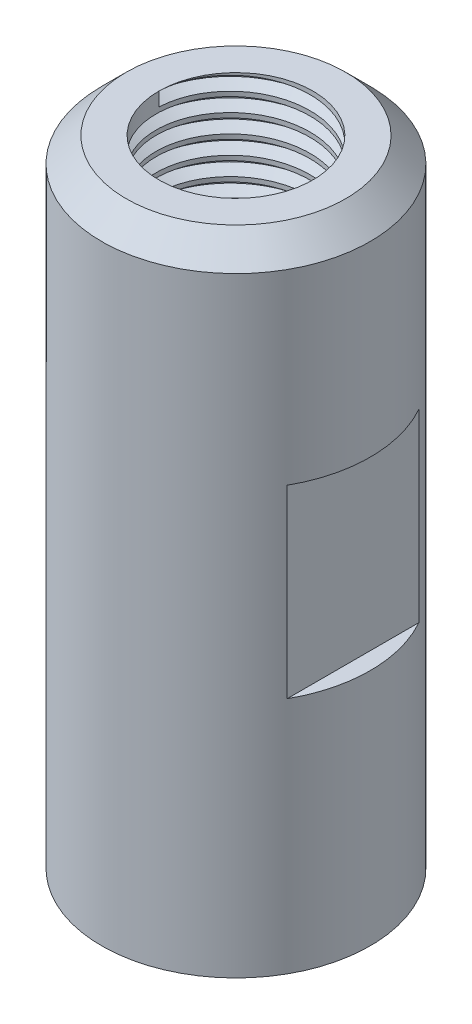
from build123d import *

# Parameters (mm, degrees)
SKETCH1_R               = 10.9
BOSS_EXTRUDE1_DEPTH     = 51.5
SKETCH2_R               = 6.25
CUT_EXTRUDE1_DEPTH      = 20
THREAD1_PITCH           = 1.5
CUT_EXTRUDE2_DEPTH      = 16
CUT_EXTRUDE2_DEPTH_BACK = 16
SKETCH23_W              = 18.439973048
SKETCH23_H              = 15
CUT_EXTRUDE3_OUTLINE_R  = 7.5
CUT_EXTRUDE3_DEPTH      = 31.5
CHAMFER1_SIZE           = 2


# Read off the part's stored shape, not the designer's step: Cut-Extrude3
with BuildPart() as part:
    # Sketch1 → Boss-Extrude1 (new body)
    with BuildSketch(Plane(origin=(0, 84, 0), x_dir=(1, 0, 0), z_dir=(0, 1, 0))):
        with Locations(Location((0, 0, 0), (0, 0, 180))):
            Circle(SKETCH1_R)
    extrude(amount=-BOSS_EXTRUDE1_DEPTH)

    # Sketch2 → Cut-Extrude1 (cut)
    with BuildSketch(Plane(origin=(0, 84, 0), x_dir=(-1, 0, 0), z_dir=(0, -1, 0))):
        with Locations(Location((0, 0, 0), (0, 0, 180))):
            Circle(SKETCH2_R)
    extrude(amount=CUT_EXTRUDE1_DEPTH, mode=Mode.SUBTRACT)

    # Thread1: the profile of Thread Profile1 profile screwed along a right-hand helix of 17.333333 turns, 8 arcs to a turn; built about Z, then put on its axis
    thread1_z = Axis((0, 0, 0), (0, 0, 1))
    thread1_corners = [(6.2497, 0, -0.000173205), (7.061898813, 0, 0.468749998), (7.061898813, 0, 0.656249998), (6.2497, 0, 1.125173201)]
    with BuildLine(mode=Mode.PRIVATE) as thread1_profile:
        Line(thread1_corners[0], thread1_corners[1])
        Line(thread1_corners[1], thread1_corners[2])
        Line(thread1_corners[2], thread1_corners[3])
        Line(thread1_corners[3], thread1_corners[0])
    thread1_cap = Face(thread1_profile.wire())
    thread1_turn_angles = [0, 22.5, 45, 67.5, 90, 112.5, 135, 157.5, 180, 202.5, 225, 247.5, 270, 292.5, 315, 337.5, 360]
    thread1_turn_weights = [1, 0.9238795325112867, 1, 0.9238795325112867, 1, 0.9238795325112867, 1, 0.9238795325112867, 1, 0.9238795325112867, 1, 0.9238795325112867, 1, 0.9238795325112867, 1, 0.9238795325112867, 1]
    thread1_turn_rails = [Edge.make_bspline([Vector(p[0], p[1], 0).rotate(thread1_z, thread1_turn_angles[k]) / thread1_turn_weights[k] + Vector(0, 0, p[2] + THREAD1_PITCH * thread1_turn_angles[k] / 360) for k in range(17)], [0, 0, 0, 1, 1, 2, 2, 3, 3, 4, 4, 5, 5, 6, 6, 7, 7, 8, 8, 8], 2, thread1_turn_weights) for p in thread1_corners]
    thread1_turn_sides = [Face.make_surface_from_curves(thread1_turn_rails[p[0]], thread1_turn_rails[p[1]]) for p in [(0, 1), (1, 2), (2, 3), (3, 0)]]
    thread1_last_angles = [6120, 6142.5, 6165, 6187.5, 6210, 6225, 6240]
    thread1_last_weights = [1, 0.9238795325112867, 1, 0.9238795325112867, 1, 0.9659258262890683, 1]
    thread1_last_rails = [Edge.make_bspline([Vector(p[0], p[1], 0).rotate(thread1_z, thread1_last_angles[k]) / thread1_last_weights[k] + Vector(0, 0, p[2] + THREAD1_PITCH * thread1_last_angles[k] / 360) for k in range(7)], [0, 0, 0, 1, 1, 2, 2, 3, 3, 3], 2, thread1_last_weights) for p in thread1_corners]
    thread1_last_sides = [Face.make_surface_from_curves(thread1_last_rails[p[0]], thread1_last_rails[p[1]]) for p in [(0, 1), (1, 2), (2, 3), (3, 0)]]
    thread1 = Plane(origin=(0, 84, 0), x_dir=(-1, 0, 0), z_dir=(0, -1, 0)) * Solid(Shell([*[p.moved(Location((0, 0, THREAD1_PITCH * i))) for i in range(17) for p in thread1_turn_sides], *thread1_last_sides, thread1_cap, thread1_cap.rotate(thread1_z, 6240).moved(Location((0, 0, THREAD1_PITCH * 6240 / 360)))]))
    add(thread1, mode=Mode.SUBTRACT)

    # Sketch23 → Cut-Extrude2 (cut, two sides: drawn at the far end of the back side and taken through both)
    with BuildSketch(Plane.XY.offset(-CUT_EXTRUDE2_DEPTH_BACK)):
        with Locations((18.719986524, 59.343499547)):
            Rectangle(SKETCH23_W, SKETCH23_H)
        with Locations((-18.719986524, 59.343499547)):
            Rectangle(SKETCH23_W, SKETCH23_H)
    extrude(amount=CUT_EXTRUDE2_DEPTH + CUT_EXTRUDE2_DEPTH_BACK, mode=Mode.SUBTRACT)

    # Cut-Extrude3 outline → Cut-Extrude3 (cut)
    with BuildSketch(Plane(origin=(0, 32.5, 0), x_dir=(-1, 0, 0), z_dir=(0, 1, 0))):
        Circle(CUT_EXTRUDE3_OUTLINE_R)
    extrude(amount=CUT_EXTRUDE3_DEPTH, mode=Mode.SUBTRACT)

    # Chamfer1
    chamfer1_edges = [part.edges().sort_by_distance(p)[0] for p in [
        (10.9, 84, 0),
    ]]
    chamfer(chamfer1_edges, length=CHAMFER1_SIZE)


solid = part.part
